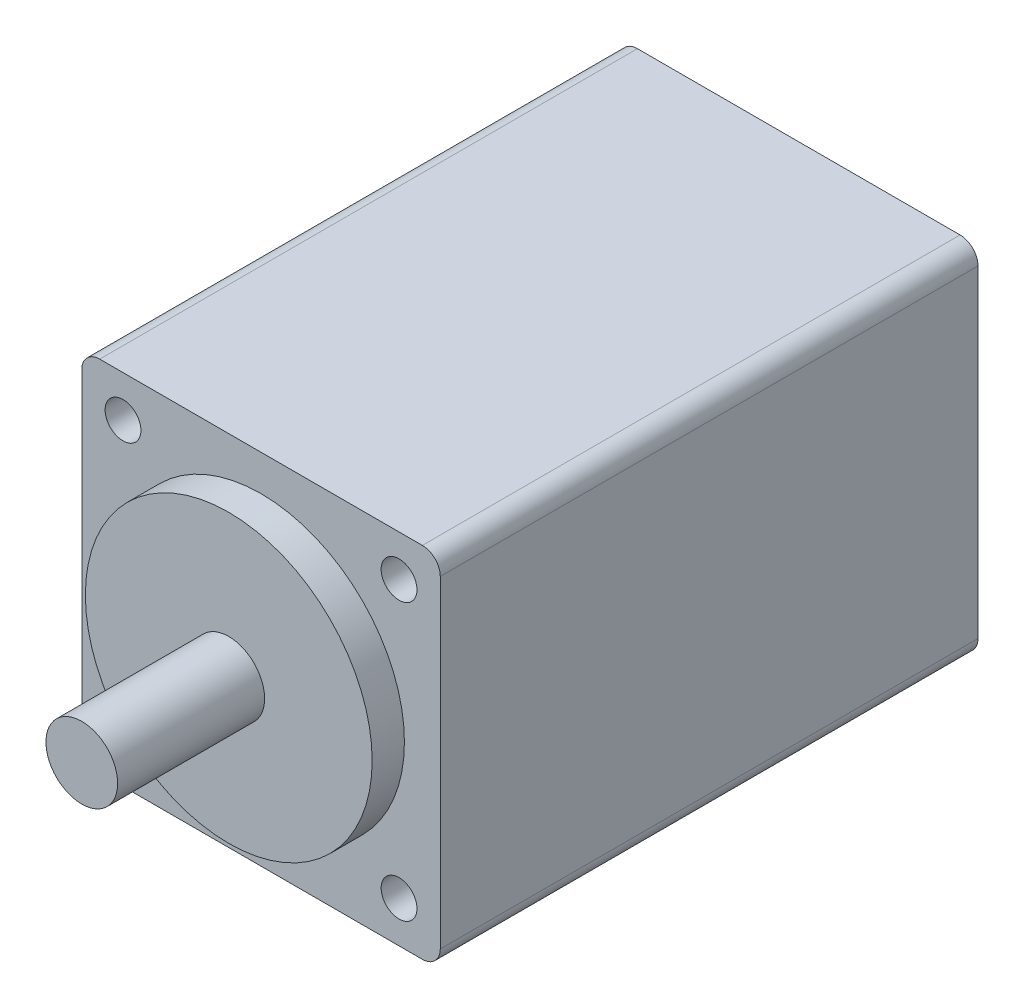
from build123d import *

# Parameters (mm, degrees)
SKETCH1_W           = 20
SKETCH1_H           = 20
BOSS_EXTRUDE1_DEPTH = 30
FILLET1_R           = 1
SKETCH2_R           = 8
BOSS_EXTRUDE2_DEPTH = 1.8
SKETCH3_R           = 2
BOSS_EXTRUDE3_DEPTH = 8.2
SKETCH4_R           = 1
CUT_EXTRUDE1_DEPTH  = 3


with BuildPart() as part:
    # Sketch1 → Boss-Extrude1 (new body)
    with BuildSketch(Plane.XY):
        Rectangle(SKETCH1_W, SKETCH1_H)
    extrude(amount=BOSS_EXTRUDE1_DEPTH)

    # Fillet1
    fillet1_edges = [part.edges().sort_by_distance(p)[0] for p in [
        (-10, -10, 15),
        (-10, 10, 15),
        (10, -10, 15),
        (10, 10, 15),
    ]]
    fillet(fillet1_edges, radius=FILLET1_R)

    # Sketch2 → Boss-Extrude2 (add)
    with BuildSketch(Plane.XY.offset(30)):
        Circle(SKETCH2_R)
    extrude(amount=BOSS_EXTRUDE2_DEPTH)

    # Sketch3 → Boss-Extrude3 (add)
    with BuildSketch(Plane.XY.offset(31.8)):
        Circle(SKETCH3_R)
    extrude(amount=BOSS_EXTRUDE3_DEPTH)

    # Sketch4 → Cut-Extrude1 (cut)
    with BuildSketch(Plane.XY.offset(30)):
        with Locations((-7.7, 7.7)):
            Circle(SKETCH4_R)
        with Locations((7.7, 7.7)):
            Circle(SKETCH4_R)
        with Locations((7.7, -7.7)):
            Circle(SKETCH4_R)
        with Locations((-7.7, -7.7)):
            Circle(SKETCH4_R)
    extrude(amount=-CUT_EXTRUDE1_DEPTH, mode=Mode.SUBTRACT)


solid = part.part
